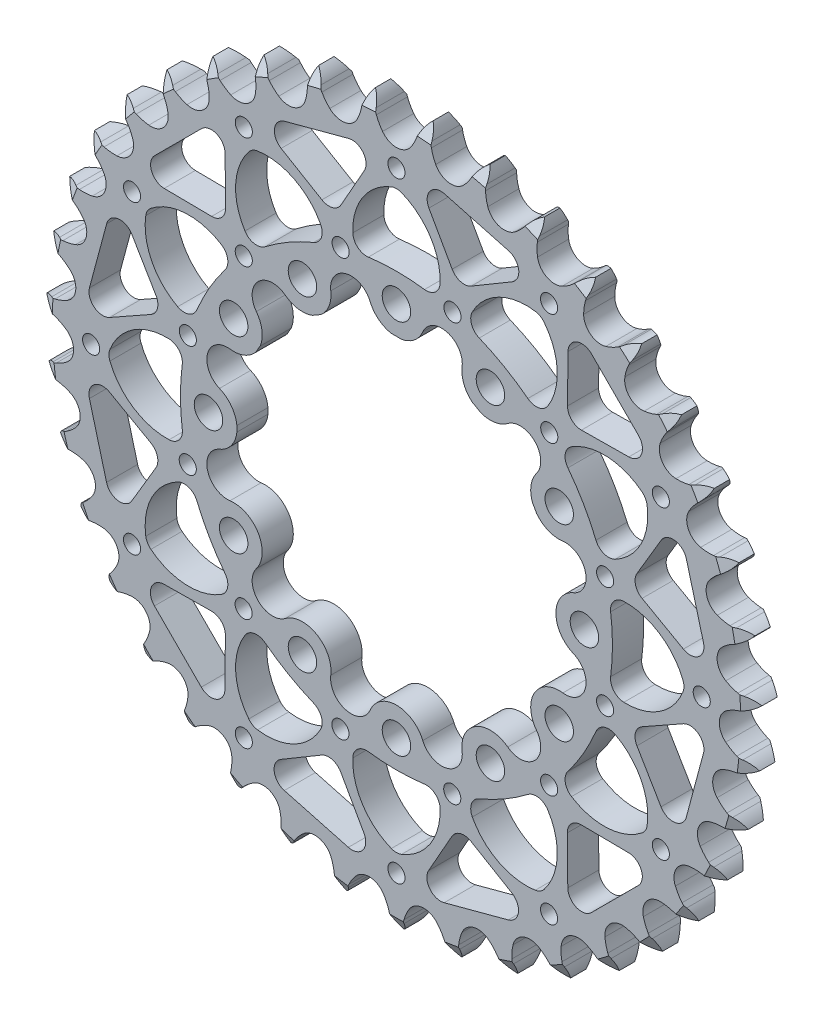
from build123d import *

# Parameters (mm, degrees)
EXTRUSION_DEPTH                = 7.2136
CIRPATTERN1_COUNT              = 12
CUT_EXTRUDE1_DEPTH             = 118.514389318
CUT_EXTRUDE1_DEPTH_BACK        = 118.514389318
SKETCH8_R                      = 37
CENTER_CUTOUT_DEPTH            = 118.514389465
CENTER_CUTOUT_DEPTH_BACK       = 118.514389465
SKETCH11_R                     = 1.984375
PATTERNED_CUTOUT_DEPTH         = 118.514389465
CBORE_FOR_M6_SHCS2_D           = 6.6
CBORE_FOR_M6_SHCS2_CBORE_D     = 11.25
CBORE_FOR_M6_SHCS2_CBORE_DEPTH = 1


with BuildPart() as part:
    # Teeth Sketch → Extrusion (new body)
    with BuildSketch(Plane.XY):
        with BuildLine():
            ThreePointArc((6.676484762, 82.703103732), (5.710873677, 81.555589606), (5.037571935, 80.215493266))
            Line((5.037571935, 80.215493266), (4.65053543, 79.150636707))
            ThreePointArc((4.65053543, 79.150636707), (4.030589042, 77.787636082), (3.22092759, 76.5280518))
            ThreePointArc((3.22092759, 76.5280518), (0, 74.905926143), (-3.22092759, 76.5280518))
            ThreePointArc((-3.22092759, 76.5280518), (-4.030589042, 77.787636082), (-4.65053543, 79.150636707))
            Line((-4.65053543, 79.150636707), (-5.037571935, 80.215493266))
            ThreePointArc((-5.037571935, 80.215493266), (-5.710873677, 81.555589606), (-6.676484762, 82.703103732))
            ThreePointArc((-6.676484762, 82.703103732), (-7.445517227, 81.415554702), (-7.895133318, 79.984807062))
            Line((-7.895133318, 79.984807062), (-8.106342797, 78.871655094))
            ThreePointArc((-8.106342797, 78.871655094), (-8.499620367, 77.426858575), (-9.096745387, 76.053706749))
            ThreePointArc((-9.096745387, 76.053706749), (-12.015755556, 73.935914073), (-15.455180235, 75.020360508))
            ThreePointArc((-15.455180235, 75.020360508), (-16.456408311, 76.133754674), (-17.286967233, 77.379658404))
            Line((-17.286967233, 77.379658404), (-17.83980672, 78.368640329))
            ThreePointArc((-17.83980672, 78.368640329), (-18.719355953, 79.583377579), (-19.856536839, 80.561136787))
            ThreePointArc((-19.856536839, 80.561136787), (-20.409073146, 79.166899696), (-20.623358765, 77.682556369))
            Line((-20.623358765, 77.682556369), (-20.653271004, 76.549939044))
            ThreePointArc((-20.653271004, 76.549939044), (-20.809694072, 75.060766102), (-21.178817437, 73.609610642))
            ThreePointArc((-21.178817437, 73.609610642), (-23.720309356, 71.051000665), (-27.289151829, 71.569681286))
            ThreePointArc((-27.289151829, 71.569681286), (-28.456015249, 72.508049011), (-29.475675664, 73.604587595))
            Line((-29.475675664, 73.604587595), (-30.179999883, 74.492080773))
            ThreePointArc((-30.179999883, 74.492080773), (-31.243016742, 75.549997876), (-32.522315041, 76.332678717))
            ThreePointArc((-32.522315041, 76.332678717), (-32.844044791, 74.867863573), (-32.817450053, 73.368368272))
            Line((-32.817450053, 73.368368272), (-32.66529034, 72.245619783))
            ThreePointArc((-32.66529034, 72.245619783), (-32.580807632, 70.750639215), (-32.71236924, 69.259064285))
            ThreePointArc((-32.71236924, 69.259064285), (-34.810519602, 66.325903661), (-38.416348726, 66.265384911))
            ThreePointArc((-38.416348726, 66.265384911), (-39.71862634, 67.004422965), (-40.900979579, 67.923196629))
            Line((-40.900979579, 67.923196629), (-41.738546902, 68.686215454))
            ThreePointArc((-41.738546902, 68.686215454), (-42.957499809, 69.559912912), (-44.345782367, 70.127244363))
            ThreePointArc((-44.345782367, 70.127244363), (-44.428372928, 68.629789109), (-44.161586623, 67.153977974))
            Line((-44.161586623, 67.153977974), (-43.831295815, 66.070176918))
            ThreePointArc((-43.831295815, 66.070176918), (-43.508095388, 64.608107935), (-43.398687863, 63.114744543))
            ThreePointArc((-43.398687863, 63.114744543), (-44.999155676, 59.883000591), (-48.54858237, 59.244849876))
            ThreePointArc((-48.54858237, 59.244849876), (-49.952545871, 59.765417561), (-51.266969607, 60.48263055))
            Line((-51.266969607, 60.48263055), (-52.21608748, 61.101413234))
            ThreePointArc((-52.21608748, 61.101413234), (-53.559406195, 61.768262742), (-55.020717224, 62.105551216))
            ThreePointArc((-55.020717224, 62.105551216), (-54.862029543, 60.614239157), (-54.361961296, 59.200334922))
            Line((-54.361961296, 59.200334922), (-53.862093752, 58.183551176))
            ThreePointArc((-53.862093752, 58.183551176), (-53.308546327, 56.792260597), (-52.961003266, 55.335786069))
            ThreePointArc((-52.961003266, 55.335786069), (-54.022337255, 51.889159262), (-57.423433231, 50.689904348))
            ThreePointArc((-57.423433231, 50.689904348), (-58.892720703, 50.978519235), (-60.305172051, 51.475596109))
            Line((-60.305172051, 51.475596109), (-61.34125882, 51.934116506))
            ThreePointArc((-61.34125882, 51.934116506), (-62.774152094, 52.376847013), (-64.270644405, 52.475356916))
            ThreePointArc((-64.270644405, 52.475356916), (-63.87478841, 51.02881225), (-63.154389727, 49.713434291))
            Line((-63.154389727, 49.713434291), (-62.497891753, 48.790002021))
            ThreePointArc((-62.497891753, 48.790002021), (-61.728333918, 47.505523541), (-61.151656504, 46.123659804))
            ThreePointArc((-61.151656504, 46.123659804), (-61.646368676, 42.551415963), (-64.811047336, 40.822116924))
            ThreePointArc((-64.811047336, 40.822116924), (-66.307605004, 40.871304038), (-67.781502216, 41.135370767))
            Line((-67.781502216, 41.135370767), (-68.877723777, 41.42175344))
            ThreePointArc((-68.877723777, 41.42175344), (-70.363080428, 41.628898458), (-71.855995657, 41.486078435))
            ThreePointArc((-71.855995657, 41.486078435), (-71.23322381, 40.12176591), (-70.311152637, 38.938981826))
            Line((-70.311152637, 38.938981826), (-69.515027187, 38.132817442))
            ThreePointArc((-69.515027187, 38.132817442), (-68.549390085, 36.988418379), (-67.75851396, 35.716954977))
            ThreePointArc((-67.75851396, 35.716954977), (-67.673791529, 32.111613343), (-70.520089358, 29.897058114))
            ThreePointArc((-70.520089358, 29.897058114), (-72.005157166, 29.705543536), (-73.502327078, 29.729760931))
            Line((-73.502327078, 29.729760931), (-74.630291869, 29.836588719))
            ThreePointArc((-74.630291869, 29.836588719), (-76.129641939, 29.8027833), (-77.580314364, 29.422332315))
            ThreePointArc((-77.580314364, 29.422332315), (-76.74675613, 28.175586908), (-75.646893627, 27.156030185))
            Line((-75.646893627, 27.156030185), (-74.731759931, 26.488012922))
            ThreePointArc((-74.731759931, 26.488012922), (-73.595053056, 25.51333261), (-72.610461496, 24.385199777))
            ThreePointArc((-72.610461496, 24.385199777), (-71.948498729, 20.840136804), (-74.402698108, 18.197681204))
            ThreePointArc((-74.402698108, 18.197681204), (-75.837813579, 17.77042506), (-77.319480277, 17.554165902))
            Line((-77.319480277, 17.554165902), (-78.449974603, 17.478672021))
            ThreePointArc((-78.449974603, 17.478672021), (-79.924485713, 17.204791709), (-81.295343681, 16.596563242))
            ThreePointArc((-81.295343681, 16.596563242), (-80.27258778, 15.499675005), (-79.023419807, 14.669751627))
            Line((-79.023419807, 14.669751627), (-78.012979347, 14.15718278))
            ThreePointArc((-78.012979347, 14.15718278), (-76.734642811, 13.377464928), (-75.58183622, 12.421880712))
            ThreePointArc((-75.58183622, 12.421880712), (-74.359777605, 9.028911669), (-76.358316059, 6.026993909))
            ThreePointArc((-76.358316059, 6.026993909), (-77.706310456, 5.375061909), (-79.134099551, 4.923927198))
            Line((-79.134099551, 4.923927198), (-80.237844202, 4.6680669))
            ThreePointArc((-80.237844202, 4.6680669), (-81.649327289, 4.161205049), (-82.904866299, 3.340951899))
            ThreePointArc((-82.904866299, 3.340951899), (-81.719401571, 2.422329661), (-80.353280924, 1.803534207))
            Line((-80.353280924, 1.803534207), (-79.273703577, 1.45968904))
            ThreePointArc((-79.273703577, 1.45968904), (-77.886845624, 0.895127931), (-76.595681088, 0.136841462))
            ThreePointArc((-76.595681088, 0.136841462), (-74.8451773, -3.016157536), (-76.336293733, -6.299789363))
            ThreePointArc((-76.336293733, -6.299789363), (-77.56225471, -7.159512522), (-78.899187214, -7.833838635))
            Line((-78.899187214, -7.833838635), (-79.947595784, -8.263438702))
            ThreePointArc((-79.947595784, -8.263438702), (-81.259494176, -8.990154635), (-82.367196428, -10.001188343))
            ThreePointArc((-82.367196428, -10.001188343), (-81.049725787, -10.717752749), (-79.602034272, -11.109393802))
            Line((-79.602034272, -11.109393802), (-78.481280524, -11.275609878))
            ThreePointArc((-78.481280524, -11.275609878), (-77.021820047, -11.610392409), (-75.625738049, -12.151741911))
            ThreePointArc((-75.625738049, -12.151741911), (-73.392126218, -14.983109845), (-74.337201497, -18.463411399))
            ThreePointArc((-74.337201497, -18.463411399), (-75.409377308, -19.50865934), (-76.620827372, -20.388712162))
            Line((-76.620827372, -20.388712162), (-77.586746629, -20.980925582))
            ThreePointArc((-77.586746629, -20.980925582), (-78.765082849, -21.908674036), (-79.696259435, -23.08430306))
            ThreePointArc((-79.696259435, -23.08430306), (-78.280904679, -23.580250992), (-76.789136745, -23.734594346))
            Line((-76.789136745, -23.734594346), (-75.656233531, -23.718876424))
            ThreePointArc((-75.656233531, -23.718876424), (-74.161969788, -23.815209685), (-72.697128119, -24.125601551))
            ThreePointArc((-72.697128119, -24.125601551), (-70.038257617, -26.562007479), (-70.41281479, -30.148840778))
            ThreePointArc((-70.41281479, -30.148840778), (-71.303436645, -31.352542128), (-72.358028349, -32.415528753))
            Line((-72.358028349, -32.415528753), (-73.216441492, -33.155017511))
            ThreePointArc((-73.216441492, -33.155017511), (-74.230697248, -34.259770288), (-74.961231185, -35.569546454))
            ThreePointArc((-74.961231185, -35.569546454), (-73.484649258, -35.832033121), (-71.987440912, -35.745081364))
            Line((-71.987440912, -35.745081364), (-70.871729829, -35.547836529))
            ThreePointArc((-70.871729829, -35.547836529), (-69.381363468, -35.403225539), (-67.885700756, -35.474620783))
            ThreePointArc((-67.885700756, -35.474620783), (-64.870434934, -37.452963072), (-64.664773166, -41.053431017))
            ThreePointArc((-64.664773166, -41.053431017), (-65.350774426, -42.384410543), (-66.221194398, -43.602800177))
            Line((-66.221194398, -43.602800177), (-66.949868978, -44.470411902))
            ThreePointArc((-66.949868978, -44.470411902), (-67.773775581, -45.723556485), (-68.284746423, -47.133557278))
            ThreePointArc((-68.284746423, -47.133557278), (-66.785180021, -47.155784414), (-65.321308173, -46.829789551))
            Line((-65.321308173, -46.829789551), (-64.251685552, -46.456126341))
            ThreePointArc((-64.251685552, -46.456126341), (-62.803816278, -46.074316448), (-61.316069403, -45.904865971))
            ThreePointArc((-61.316069403, -45.904865971), (-58.022502061, -47.373906594), (-57.241947884, -50.894758957))
            ThreePointArc((-57.241947884, -50.894758957), (-57.705561477, -52.318544989), (-58.369266298, -53.66078198))
            Line((-58.369266298, -53.66078198), (-58.949330025, -54.634045983))
            ThreePointArc((-58.949330025, -54.634045983), (-59.561548726, -56.003126587), (-59.839722596, -57.476833727))
            ThreePointArc((-59.839722596, -57.476833727), (-58.356009703, -57.25822566), (-56.963387864, -56.701630787))
            Line((-56.963387864, -56.701630787), (-55.967556369, -56.161226883))
            ThreePointArc((-55.967556369, -56.161226883), (-54.599683236, -55.552106762), (-53.15838406, -55.146199243))
            ThreePointArc((-53.15838406, -55.146199243), (-49.671816862, -56.06789082), (-48.336586219, -59.417939375))
            ThreePointArc((-48.336586219, -59.417939375), (-48.565804798, -60.897656602), (-49.00560486, -62.328977716))
            Line((-49.00560486, -62.328977716), (-49.422034389, -63.382686971))
            ThreePointArc((-49.422034389, -63.382686971), (-49.806709045, -64.832245127), (-49.844881387, -66.331490374))
            ThreePointArc((-49.844881387, -66.331490374), (-48.415449386, -65.877708938), (-47.130145731, -65.104929569))
            Line((-47.130145731, -65.104929569), (-46.233896874, -64.411781148))
            ThreePointArc((-46.233896874, -64.411781148), (-44.981447078, -63.591126692), (-43.623924493, -62.959274922))
            ThreePointArc((-43.623924493, -62.959274922), (-40.034657698, -63.309746125), (-38.179332362, -66.402226373))
            ThreePointArc((-38.179332362, -66.402226373), (-38.168219284, -67.899550896), (-38.372723998, -69.38288567))
            Line((-38.372723998, -69.38288567), (-38.614734022, -70.489749661))
            ThreePointArc((-38.614734022, -70.489749661), (-38.761901763, -71.982242573), (-38.559083932, -73.468196262))
            ThreePointArc((-38.559083932, -73.468196262), (-37.220954361, -72.790994159), (-36.076257579, -71.822044874))
            Line((-36.076257579, -71.822044874), (-35.302803736, -70.994104116))
            ThreePointArc((-35.302803736, -70.994104116), (-34.198215068, -69.983169844), (-32.959628196, -69.141738451))
            ThreePointArc((-32.959628196, -69.141738451), (-29.360621929, -68.91191226), (-27.033253851, -71.666730588))
            ThreePointArc((-27.033253851, -71.666730588), (-26.78209694, -73.142882488), (-26.74600974, -74.639813329))
            Line((-26.74600974, -74.639813329), (-26.807332328, -75.77116486))
            ThreePointArc((-26.807332328, -75.77116486), (-26.713181585, -77.267937748), (-26.274626458, -78.702114459))
            ThreePointArc((-26.274626458, -78.702114459), (-25.06245617, -77.819030866), (-24.088013307, -76.679006943))
            Line((-24.088013307, -76.679006943), (-23.457386525, -75.737717079))
            ThreePointArc((-23.457386525, -75.737717079), (-22.529267252, -74.562685657), (-21.441694841, -73.533467273))
            ThreePointArc((-21.441694841, -73.533467273), (-17.926161474, -72.729296065), (-15.187028265, -75.075104125))
            ThreePointArc((-15.187028265, -75.075104125), (-14.702332353, -76.491851845), (-14.426587879, -77.96360903))
            Line((-14.426587879, -77.96360903), (-14.305634807, -79.090146691))
            ThreePointArc((-14.305634807, -79.090146691), (-13.972604036, -80.552433921), (-13.309669959, -81.897689231))
            ThreePointArc((-13.309669959, -81.897689231), (-12.254853529, -80.83159555), (-11.475902142, -79.55002301))
            Line((-11.475902142, -79.55002301), (-11.004435324, -78.519762952))
            ThreePointArc((-11.004435324, -78.519762952), (-10.276823247, -77.211067077), (-9.368432854, -76.020717918))
            ThreePointArc((-9.368432854, -76.020717918), (-6.027422853, -74.663029306), (-2.947466624, -76.5390719))
            ThreePointArc((-2.947466624, -76.5390719), (-2.241785081, -77.859722417), (-1.733524971, -79.26818821))
            Line((-1.733524971, -79.26818821), (-1.43342886, -80.360735266))
            ThreePointArc((-1.43342886, -80.360735266), (-0.870143382, -81.750664368), (0, -82.97215687))
            ThreePointArc((0, -82.97215687), (0.870143382, -81.750664368), (1.43342886, -80.360735266))
            Line((1.43342886, -80.360735266), (1.733524971, -79.26818821))
            ThreePointArc((1.733524971, -79.26818821), (2.241785081, -77.859722417), (2.947466624, -76.5390719))
            ThreePointArc((2.947466624, -76.5390719), (6.027422853, -74.663029306), (9.368432854, -76.020717918))
            ThreePointArc((9.368432854, -76.020717918), (10.276823247, -77.211067077), (11.004435324, -78.519762952))
            Line((11.004435324, -78.519762952), (11.475902142, -79.55002301))
            ThreePointArc((11.475902142, -79.55002301), (12.254853529, -80.83159555), (13.309669959, -81.897689231))
            ThreePointArc((13.309669959, -81.897689231), (13.972604036, -80.552433921), (14.305634807, -79.090146691))
            Line((14.305634807, -79.090146691), (14.426587879, -77.96360903))
            ThreePointArc((14.426587879, -77.96360903), (14.702332353, -76.491851845), (15.187028265, -75.075104125))
            ThreePointArc((15.187028265, -75.075104125), (17.926161474, -72.729296065), (21.441694841, -73.533467273))
            ThreePointArc((21.441694841, -73.533467273), (22.529267252, -74.562685657), (23.457386525, -75.737717079))
            Line((23.457386525, -75.737717079), (24.088013307, -76.679006943))
            ThreePointArc((24.088013307, -76.679006943), (25.06245617, -77.819030866), (26.274626458, -78.702114459))
            ThreePointArc((26.274626458, -78.702114459), (26.713181585, -77.267937748), (26.807332328, -75.77116486))
            Line((26.807332328, -75.77116486), (26.74600974, -74.639813329))
            ThreePointArc((26.74600974, -74.639813329), (26.78209694, -73.142882488), (27.033253851, -71.666730588))
            ThreePointArc((27.033253851, -71.666730588), (29.360621929, -68.91191226), (32.959628196, -69.141738451))
            ThreePointArc((32.959628196, -69.141738451), (34.198215068, -69.983169844), (35.302803736, -70.994104116))
            Line((35.302803736, -70.994104116), (36.076257579, -71.822044874))
            ThreePointArc((36.076257579, -71.822044874), (37.220954361, -72.790994159), (38.559083932, -73.468196262))
            ThreePointArc((38.559083932, -73.468196262), (38.761901763, -71.982242573), (38.614734022, -70.489749661))
            Line((38.614734022, -70.489749661), (38.372723998, -69.38288567))
            ThreePointArc((38.372723998, -69.38288567), (38.168219284, -67.899550896), (38.179332362, -66.402226373))
            ThreePointArc((38.179332362, -66.402226373), (40.034657698, -63.309746125), (43.623924493, -62.959274922))
            ThreePointArc((43.623924493, -62.959274922), (44.981447078, -63.591126692), (46.233896874, -64.411781148))
            Line((46.233896874, -64.411781148), (47.130145731, -65.104929569))
            ThreePointArc((47.130145731, -65.104929569), (48.415449386, -65.877708938), (49.844881387, -66.331490374))
            ThreePointArc((49.844881387, -66.331490374), (49.806709045, -64.832245127), (49.422034389, -63.382686971))
            Line((49.422034389, -63.382686971), (49.00560486, -62.328977716))
            ThreePointArc((49.00560486, -62.328977716), (48.565804798, -60.897656602), (48.336586219, -59.417939375))
            ThreePointArc((48.336586219, -59.417939375), (49.671816862, -56.06789082), (53.15838406, -55.146199243))
            ThreePointArc((53.15838406, -55.146199243), (54.599683236, -55.552106762), (55.967556369, -56.161226883))
            Line((55.967556369, -56.161226883), (56.963387864, -56.701630787))
            ThreePointArc((56.963387864, -56.701630787), (58.356009703, -57.25822566), (59.839722596, -57.476833727))
            ThreePointArc((59.839722596, -57.476833727), (59.561548726, -56.003126587), (58.949330025, -54.634045983))
            Line((58.949330025, -54.634045983), (58.369266298, -53.66078198))
            ThreePointArc((58.369266298, -53.66078198), (57.705561477, -52.318544989), (57.241947884, -50.894758957))
            ThreePointArc((57.241947884, -50.894758957), (58.022502061, -47.373906594), (61.316069403, -45.904865971))
            ThreePointArc((61.316069403, -45.904865971), (62.803816278, -46.074316448), (64.251685552, -46.456126341))
            Line((64.251685552, -46.456126341), (65.321308173, -46.829789551))
            ThreePointArc((65.321308173, -46.829789551), (66.785180021, -47.155784414), (68.284746423, -47.133557278))
            ThreePointArc((68.284746423, -47.133557278), (67.773775581, -45.723556485), (66.949868978, -44.470411902))
            Line((66.949868978, -44.470411902), (66.221194398, -43.602800177))
            ThreePointArc((66.221194398, -43.602800177), (65.350774426, -42.384410543), (64.664773166, -41.053431017))
            ThreePointArc((64.664773166, -41.053431017), (64.870434934, -37.452963072), (67.885700756, -35.474620783))
            ThreePointArc((67.885700756, -35.474620783), (69.381363468, -35.403225539), (70.871729829, -35.547836529))
            Line((70.871729829, -35.547836529), (71.987440912, -35.745081364))
            ThreePointArc((71.987440912, -35.745081364), (73.484649258, -35.832033121), (74.961231185, -35.569546454))
            ThreePointArc((74.961231185, -35.569546454), (74.230697248, -34.259770288), (73.216441492, -33.155017511))
            Line((73.216441492, -33.155017511), (72.358028349, -32.415528753))
            ThreePointArc((72.358028349, -32.415528753), (71.303436645, -31.352542128), (70.41281479, -30.148840778))
            ThreePointArc((70.41281479, -30.148840778), (70.038257617, -26.562007479), (72.697128119, -24.125601551))
            ThreePointArc((72.697128119, -24.125601551), (74.161969788, -23.815209685), (75.656233531, -23.718876424))
            Line((75.656233531, -23.718876424), (76.789136745, -23.734594346))
            ThreePointArc((76.789136745, -23.734594346), (78.280904679, -23.580250992), (79.696259435, -23.08430306))
            ThreePointArc((79.696259435, -23.08430306), (78.765082849, -21.908674036), (77.586746629, -20.980925582))
            Line((77.586746629, -20.980925582), (76.620827372, -20.388712162))
            ThreePointArc((76.620827372, -20.388712162), (75.409377308, -19.50865934), (74.337201497, -18.463411399))
            ThreePointArc((74.337201497, -18.463411399), (73.392126218, -14.983109845), (75.625738049, -12.151741911))
            ThreePointArc((75.625738049, -12.151741911), (77.021820047, -11.610392409), (78.481280524, -11.275609878))
            Line((78.481280524, -11.275609878), (79.602034272, -11.109393802))
            ThreePointArc((79.602034272, -11.109393802), (81.049725787, -10.717752749), (82.367196428, -10.001188343))
            ThreePointArc((82.367196428, -10.001188343), (81.259494176, -8.990154635), (79.947595784, -8.263438702))
            Line((79.947595784, -8.263438702), (78.899187214, -7.833838635))
            ThreePointArc((78.899187214, -7.833838635), (77.56225471, -7.159512522), (76.336293733, -6.299789363))
            ThreePointArc((76.336293733, -6.299789363), (74.8451773, -3.016157536), (76.595681088, 0.136841462))
            ThreePointArc((76.595681088, 0.136841462), (77.886845624, 0.895127931), (79.273703577, 1.45968904))
            Line((79.273703577, 1.45968904), (80.353280924, 1.803534207))
            ThreePointArc((80.353280924, 1.803534207), (81.719401571, 2.422329661), (82.904866299, 3.340951899))
            ThreePointArc((82.904866299, 3.340951899), (81.649327289, 4.161205049), (80.237844202, 4.6680669))
            Line((80.237844202, 4.6680669), (79.134099551, 4.923927198))
            ThreePointArc((79.134099551, 4.923927198), (77.706310456, 5.375061909), (76.358316059, 6.026993909))
            ThreePointArc((76.358316059, 6.026993909), (74.359777605, 9.028911669), (75.58183622, 12.421880712))
            ThreePointArc((75.58183622, 12.421880712), (76.734642811, 13.377464928), (78.012979347, 14.15718278))
            Line((78.012979347, 14.15718278), (79.023419807, 14.669751627))
            ThreePointArc((79.023419807, 14.669751627), (80.27258778, 15.499675005), (81.295343681, 16.596563242))
            ThreePointArc((81.295343681, 16.596563242), (79.924485713, 17.204791709), (78.449974603, 17.478672021))
            Line((78.449974603, 17.478672021), (77.319480277, 17.554165902))
            ThreePointArc((77.319480277, 17.554165902), (75.837813579, 17.77042506), (74.402698108, 18.197681204))
            ThreePointArc((74.402698108, 18.197681204), (71.948498729, 20.840136804), (72.610461496, 24.385199777))
            ThreePointArc((72.610461496, 24.385199777), (73.595053056, 25.51333261), (74.731759931, 26.488012922))
            Line((74.731759931, 26.488012922), (75.646893627, 27.156030185))
            ThreePointArc((75.646893627, 27.156030185), (76.74675613, 28.175586908), (77.580314364, 29.422332315))
            ThreePointArc((77.580314364, 29.422332315), (76.129641939, 29.8027833), (74.630291869, 29.836588719))
            Line((74.630291869, 29.836588719), (73.502327078, 29.729760931))
            ThreePointArc((73.502327078, 29.729760931), (72.005157166, 29.705543536), (70.520089358, 29.897058114))
            ThreePointArc((70.520089358, 29.897058114), (67.673791529, 32.111613343), (67.75851396, 35.716954977))
            ThreePointArc((67.75851396, 35.716954977), (68.549390085, 36.988418379), (69.515027187, 38.132817442))
            Line((69.515027187, 38.132817442), (70.311152637, 38.938981826))
            ThreePointArc((70.311152637, 38.938981826), (71.23322381, 40.12176591), (71.855995657, 41.486078435))
            ThreePointArc((71.855995657, 41.486078435), (70.363080428, 41.628898458), (68.877723777, 41.42175344))
            Line((68.877723777, 41.42175344), (67.781502216, 41.135370767))
            ThreePointArc((67.781502216, 41.135370767), (66.307605004, 40.871304038), (64.811047336, 40.822116924))
            ThreePointArc((64.811047336, 40.822116924), (61.646368676, 42.551415963), (61.151656504, 46.123659804))
            ThreePointArc((61.151656504, 46.123659804), (61.728333918, 47.505523541), (62.497891753, 48.790002021))
            Line((62.497891753, 48.790002021), (63.154389727, 49.713434291))
            ThreePointArc((63.154389727, 49.713434291), (63.87478841, 51.02881225), (64.270644405, 52.475356916))
            ThreePointArc((64.270644405, 52.475356916), (62.774152094, 52.376847013), (61.34125882, 51.934116506))
            Line((61.34125882, 51.934116506), (60.305172051, 51.475596109))
            ThreePointArc((60.305172051, 51.475596109), (58.892720703, 50.978519235), (57.423433231, 50.689904348))
            ThreePointArc((57.423433231, 50.689904348), (54.022337255, 51.889159262), (52.961003266, 55.335786069))
            ThreePointArc((52.961003266, 55.335786069), (53.308546327, 56.792260597), (53.862093752, 58.183551176))
            Line((53.862093752, 58.183551176), (54.361961296, 59.200334922))
            ThreePointArc((54.361961296, 59.200334922), (54.862029543, 60.614239157), (55.020717224, 62.105551216))
            ThreePointArc((55.020717224, 62.105551216), (53.559406195, 61.768262742), (52.21608748, 61.101413234))
            Line((52.21608748, 61.101413234), (51.266969607, 60.48263055))
            ThreePointArc((51.266969607, 60.48263055), (49.952545871, 59.765417561), (48.54858237, 59.244849876))
            ThreePointArc((48.54858237, 59.244849876), (44.999155676, 59.883000591), (43.398687863, 63.114744543))
            ThreePointArc((43.398687863, 63.114744543), (43.508095388, 64.608107935), (43.831295815, 66.070176918))
            Line((43.831295815, 66.070176918), (44.161586623, 67.153977974))
            ThreePointArc((44.161586623, 67.153977974), (44.428372928, 68.629789109), (44.345782367, 70.127244363))
            ThreePointArc((44.345782367, 70.127244363), (42.957499809, 69.559912912), (41.738546902, 68.686215454))
            Line((41.738546902, 68.686215454), (40.900979579, 67.923196629))
            ThreePointArc((40.900979579, 67.923196629), (39.71862634, 67.004422965), (38.416348726, 66.265384911))
            ThreePointArc((38.416348726, 66.265384911), (34.810519602, 66.325903661), (32.71236924, 69.259064285))
            ThreePointArc((32.71236924, 69.259064285), (32.580807632, 70.750639215), (32.66529034, 72.245619783))
            Line((32.66529034, 72.245619783), (32.817450053, 73.368368272))
            ThreePointArc((32.817450053, 73.368368272), (32.844044791, 74.867863573), (32.522315041, 76.332678717))
            ThreePointArc((32.522315041, 76.332678717), (31.243016742, 75.549997876), (30.179999883, 74.492080773))
            Line((30.179999883, 74.492080773), (29.475675664, 73.604587595))
            ThreePointArc((29.475675664, 73.604587595), (28.456015249, 72.508049011), (27.289151829, 71.569681286))
            ThreePointArc((27.289151829, 71.569681286), (23.720309356, 71.051000665), (21.178817437, 73.609610642))
            ThreePointArc((21.178817437, 73.609610642), (20.809694072, 75.060766102), (20.653271004, 76.549939044))
            Line((20.653271004, 76.549939044), (20.623358765, 77.682556369))
            ThreePointArc((20.623358765, 77.682556369), (20.409073146, 79.166899696), (19.856536839, 80.561136787))
            ThreePointArc((19.856536839, 80.561136787), (18.719355953, 79.583377579), (17.83980672, 78.368640329))
            Line((17.83980672, 78.368640329), (17.286967233, 77.379658404))
            ThreePointArc((17.286967233, 77.379658404), (16.456408311, 76.133754674), (15.455180235, 75.020360508))
            ThreePointArc((15.455180235, 75.020360508), (12.015755556, 73.935914073), (9.096745387, 76.053706749))
            ThreePointArc((9.096745387, 76.053706749), (8.499620367, 77.426858575), (8.106342797, 78.871655094))
            Line((8.106342797, 78.871655094), (7.895133318, 79.984807062))
            ThreePointArc((7.895133318, 79.984807062), (7.445517227, 81.415554702), (6.676484762, 82.703103732))
        make_face()
    extrude(amount=EXTRUSION_DEPTH)

    # Sketch4 → M6 Clearance Hole1 (revolve, cut)
    with BuildSketch(Plane(origin=(0, 43.500000122, 0), x_dir=(0, 1, 0), z_dir=(1, 0, 0))):
        Polygon((0, 0), (0, 19.254840043), (3.3, 17.272), (3.3, 0), align=None)
    m6_clearance_hole1 = revolve(axis=Axis((0, 43.500000122, -6.35), (0, 0, 1)), mode=Mode.SUBTRACT)

    # CirPattern1: M6 Clearance Hole1 ×12 about axis
    cirpattern1_axis = Axis((0, -0.078817912, 0), (0, 0, 1))
    for i in range(1, CIRPATTERN1_COUNT):
        add(m6_clearance_hole1.rotate(cirpattern1_axis, i * 360 / CIRPATTERN1_COUNT), mode=Mode.SUBTRACT)

    # Sketch8 → Cut-Extrude1 (cut, two sides: drawn at the far end of the back side and taken through both)
    with BuildSketch(Plane(origin=(0, 0, 0), x_dir=(-1, 0, 0), z_dir=(0, 0, -1)).offset(-CUT_EXTRUDE1_DEPTH_BACK)):
        Circle(SKETCH8_R)
    extrude(amount=CUT_EXTRUDE1_DEPTH + CUT_EXTRUDE1_DEPTH_BACK, mode=Mode.SUBTRACT)

    # Sketch5 → Cut-Revolve1 (revolve, cut)
    with BuildSketch(Plane(origin=(0, 0, 0), x_dir=(0, 0, -1), z_dir=(1, 0, 0))):
        Polygon((-7.2136, -79.778574738), (-7.2136, -82.97215687), (-5.3848, -82.97215687), align=None)
    cut_revolve1 = revolve(axis=Axis((0, 0, 7.2136), (0, 0, -1)), mode=Mode.SUBTRACT)

    # Mirror1: Cut-Revolve1 across plane
    add(cut_revolve1.mirror(Plane.XY.offset(3.6068)), mode=Mode.SUBTRACT)

    # Sketch9 → Center Cutout (cut, two sides: drawn at the far end of the back side and taken through both)
    with BuildSketch(Plane.XY.offset(7.2136).offset(-CENTER_CUTOUT_DEPTH_BACK)):
        with BuildLine():
            ThreePointArc((1.148678559, 36.982165128), (0, 36.881719723), (-1.148678559, 36.982165128))
            ThreePointArc((-1.148678559, 36.982165128), (-9.617726785, 35.728130814), (-17.571834052, 32.561183149))
            ThreePointArc((-17.571834052, 32.561183149), (-18.475078878, 31.932946165), (-19.469920872, 31.463028799))
            ThreePointArc((-19.469920872, 31.463028799), (-22.757183287, 31.114405097), (-25.803005362, 32.399162099))
            ThreePointArc((-25.803005362, 32.399162099), (-32.058776499, 31.979958587), (-32.477980012, 25.72418745))
            ThreePointArc((-32.477980012, 25.72418745), (-31.470213373, 23.82881041), (-31.122083086, 21.710591105))
            ThreePointArc((-31.122083086, 21.710591105), (-31.241007029, 20.461591061), (-31.59350497, 19.257477605))
            ThreePointArc((-31.59350497, 19.257477605), (-32.00358372, 18.410440597), (-32.529655862, 17.630130162))
            ThreePointArc((-32.529655862, 17.630130162), (-35.22884515, 15.587363925), (-38.585048144, 15.14643516))
            ThreePointArc((-38.585048144, 15.14643516), (-43.793103112, 11.655508701), (-41.028258435, 6.02825022))
            ThreePointArc((-41.028258435, 6.02825022), (-38.265449818, 3.867034802), (-36.99517654, 0.597421776))
            ThreePointArc((-36.99517654, 0.597421776), (-36.969203034, 0.259745217), (-36.960537635, -0.078817912))
            ThreePointArc((-36.960537635, -0.078817912), (-36.968601511, -0.405426166), (-36.992773486, -0.731238524))
            ThreePointArc((-36.992773486, -0.731238524), (-38.258321936, -4.015054276), (-41.028258435, -6.185886044))
            ThreePointArc((-41.028258435, -6.185886044), (-43.793103112, -11.813144525), (-38.585048144, -15.304070984))
            ThreePointArc((-38.585048144, -15.304070984), (-33.369363855, -16.898720145), (-31.122083086, -21.868226929))
            ThreePointArc((-31.122083086, -21.868226929), (-31.470213373, -23.986446234), (-32.477980012, -25.881823274))
            ThreePointArc((-32.477980012, -25.881823274), (-32.058776499, -32.137594411), (-25.803005362, -32.556797924))
            ThreePointArc((-25.803005362, -32.556797924), (-18.853550589, -31.887708499), (-15.171128618, -37.819181396))
            ThreePointArc((-15.171128618, -37.819181396), (-15.184673592, -38.242389865), (-15.225253072, -38.663866056))
            ThreePointArc((-15.225253072, -38.663866056), (-11.734326613, -43.871921024), (-6.107068132, -41.107076347))
            ThreePointArc((-6.107068132, -41.107076347), (0, -37.039355547), (6.107068132, -41.107076347))
            ThreePointArc((6.107068132, -41.107076347), (11.734326613, -43.871921024), (15.225253072, -38.663866056))
            ThreePointArc((15.225253072, -38.663866056), (18.480268818, -32.087582442), (25.803005362, -32.556797924))
            ThreePointArc((25.803005362, -32.556797924), (32.058776499, -32.137594411), (32.477980012, -25.881823274))
            ThreePointArc((32.477980012, -25.881823274), (31.135298942, -22.286267386), (32.013950026, -18.550121394))
            ThreePointArc((32.013950026, -18.550121394), (35.635096733, -9.956901166), (36.992773486, -0.731238524))
            ThreePointArc((36.992773486, -0.731238524), (36.96054846, -0.066847918), (36.99517654, 0.597421776))
            ThreePointArc((36.99517654, 0.597421776), (35.79041588, 9.383289996), (32.529655862, 17.630130162))
            ThreePointArc((32.529655862, 17.630130162), (32.00358372, 18.410440597), (31.59350497, 19.257477605))
            ThreePointArc((31.59350497, 19.257477605), (31.183132, 22.607447115), (32.477980012, 25.72418745))
            ThreePointArc((32.477980012, 25.72418745), (32.058776499, 31.979958587), (25.803005362, 32.399162099))
            ThreePointArc((25.803005362, 32.399162099), (22.757183287, 31.114405097), (19.469920872, 31.463028799))
            ThreePointArc((19.469920872, 31.463028799), (18.475078878, 31.932946165), (17.571834052, 32.561183149))
            ThreePointArc((17.571834052, 32.561183149), (9.617726785, 35.728130814), (1.148678559, 36.982165128))
        make_face()
        with BuildLine():
            ThreePointArc((41.028258435, -6.185886044), (38.258321936, -4.015054276), (36.992773486, -0.731238524))
            ThreePointArc((36.992773486, -0.731238524), (35.635096733, -9.956901166), (32.013950026, -18.550121394))
            ThreePointArc((32.013950026, -18.550121394), (34.809147042, -15.934458682), (38.585048144, -15.304070984))
            ThreePointArc((38.585048144, -15.304070984), (43.793103112, -11.813144525), (41.028258435, -6.185886044))
        make_face()
        with BuildLine():
            ThreePointArc((41.028258435, 6.02825022), (43.793103112, 11.655508701), (38.585048144, 15.14643516))
            ThreePointArc((38.585048144, 15.14643516), (35.22884515, 15.587363925), (32.529655862, 17.630130162))
            ThreePointArc((32.529655862, 17.630130162), (35.79041588, 9.383289996), (36.99517654, 0.597421776))
            ThreePointArc((36.99517654, 0.597421776), (38.265449818, 3.867034802), (41.028258435, 6.02825022))
        make_face()
        with BuildLine():
            ThreePointArc((-1.148678559, 36.982165128), (-4.134765232, 38.332278002), (-6.107068132, 40.949440523))
            ThreePointArc((-6.107068132, 40.949440523), (-11.734326613, 43.7142852), (-15.225253072, 38.506230231))
            ThreePointArc((-15.225253072, 38.506230231), (-15.184673592, 38.08475404), (-15.171128618, 37.661545572))
            ThreePointArc((-15.171128618, 37.661545572), (-15.801307099, 34.842987278), (-17.571834052, 32.561183149))
            ThreePointArc((-17.571834052, 32.561183149), (-9.617726785, 35.728130814), (-1.148678559, 36.982165128))
        make_face()
        with BuildLine():
            ThreePointArc((15.225253072, 38.506230231), (11.734326613, 43.7142852), (6.107068132, 40.949440523))
            ThreePointArc((6.107068132, 40.949440523), (4.134765232, 38.332278002), (1.148678559, 36.982165128))
            ThreePointArc((1.148678559, 36.982165128), (9.617726785, 35.728130814), (17.571834052, 32.561183149))
            ThreePointArc((17.571834052, 32.561183149), (15.633328563, 35.231667205), (15.225253072, 38.506230231))
        make_face()
    extrude(amount=CENTER_CUTOUT_DEPTH + CENTER_CUTOUT_DEPTH_BACK, mode=Mode.SUBTRACT)

    # Sketch11 → Patterned Cutout (cut, through all)
    with BuildSketch(Plane.XY.offset(7.2136)):
        with Locations((12.985733143, 48.365954662)):
            Circle(SKETCH11_R)
        with Locations((35.428952119, 35.393278844)):
            Circle(SKETCH11_R)
        with Locations((48.379011987, 12.937002543)):
            Circle(SKETCH11_R)
        with Locations((48.365954662, -12.985733143)):
            Circle(SKETCH11_R)
        with Locations((35.393278844, -35.428952119)):
            Circle(SKETCH11_R)
        with Locations((12.937002543, -48.379011987)):
            Circle(SKETCH11_R)
        with Locations((-12.985733143, -48.365954662)):
            Circle(SKETCH11_R)
        with Locations((-35.428952119, -35.393278844)):
            Circle(SKETCH11_R)
        with Locations((-48.379011987, -12.937002543)):
            Circle(SKETCH11_R)
        with Locations((-48.365954662, 12.985733143)):
            Circle(SKETCH11_R)
        with Locations((-35.393278844, 35.428952119)):
            Circle(SKETCH11_R)
        with Locations((-12.937002543, 48.379011987)):
            Circle(SKETCH11_R)
        with Locations((0, 70.777173596)):
            Circle(SKETCH11_R)
        with Locations((35.388586798, 61.294830342)):
            Circle(SKETCH11_R)
        with Locations((61.294830342, 35.388586798)):
            Circle(SKETCH11_R)
        with Locations((70.777173596, 0)):
            Circle(SKETCH11_R)
        with Locations((61.294830342, -35.388586798)):
            Circle(SKETCH11_R)
        with Locations((35.388586798, -61.294830342)):
            Circle(SKETCH11_R)
        with Locations((0, -70.777173596)):
            Circle(SKETCH11_R)
        with Locations((-35.388586798, -61.294830342)):
            Circle(SKETCH11_R)
        with Locations((-61.294830342, -35.388586798)):
            Circle(SKETCH11_R)
        with Locations((-70.777173596, 0)):
            Circle(SKETCH11_R)
        with Locations((-61.294830342, 35.388586798)):
            Circle(SKETCH11_R)
        with Locations((-35.388586798, 61.294830342)):
            Circle(SKETCH11_R)
        with BuildLine():
            Line((25.997282294, 67.18379982), (11.149295872, 71.170322793))
            ThreePointArc((11.149295872, 71.170322793), (7.791655009, 70.042295545), (7.530287758, 66.509890586))
            Line((7.530287758, 66.509890586), (12.918562286, 56.934502126))
            ThreePointArc((12.918562286, 56.934502126), (14.877807432, 55.413071545), (17.33561802, 55.74857067))
            Line((17.33561802, 55.74857067), (26.795329914, 61.337436156))
            ThreePointArc((26.795329914, 61.337436156), (28.338394384, 64.525719343), (25.997282294, 67.18379982))
        make_face()
        with BuildLine():
            Line((39.655054183, 42.84744405), (39.776365789, 53.834110971))
            ThreePointArc((39.776365789, 53.834110971), (41.768918948, 56.762579777), (45.240734856, 56.060659598))
            Line((45.240734856, 56.060659598), (56.106206806, 45.18423622))
            ThreePointArc((56.106206806, 45.18423622), (56.80462911, 41.711714957), (53.874154487, 39.722112957))
            Line((53.874154487, 39.722112957), (42.887370931, 39.611869415))
            ThreePointArc((42.887370931, 39.611869415), (40.591094961, 40.550223944), (39.655054183, 42.84744405))
        make_face()
        with BuildLine():
            Line((55.766006336, 17.279447943), (61.364398729, 26.733524797))
            ThreePointArc((61.364398729, 26.733524797), (64.554234786, 28.273376597), (67.20995547, 25.929587937))
            Line((67.20995547, 25.929587937), (71.181518514, 11.077593014))
            ThreePointArc((71.181518514, 11.077593014), (70.05010934, 7.721090233), (66.517442872, 7.46328167))
            Line((66.517442872, 7.46328167), (56.947487435, 12.861199739))
            ThreePointArc((56.947487435, 12.861199739), (55.428031376, 14.821976584), (55.766006336, 17.279447943))
        make_face()
        with BuildLine():
            Line((56.934502126, -12.918562286), (66.509890586, -7.530287758))
            ThreePointArc((66.509890586, -7.530287758), (70.042295545, -7.791655009), (71.170322793, -11.149295872))
            Line((71.170322793, -11.149295872), (67.18379982, -25.997282294))
            ThreePointArc((67.18379982, -25.997282294), (64.525719343, -28.338394384), (61.337436156, -26.795329914))
            Line((61.337436156, -26.795329914), (55.74857067, -17.33561802))
            ThreePointArc((55.74857067, -17.33561802), (55.413071545, -14.877807432), (56.934502126, -12.918562286))
        make_face()
        with BuildLine():
            Line((42.84744405, -39.655054183), (53.834110971, -39.776365789))
            ThreePointArc((53.834110971, -39.776365789), (56.762579777, -41.768918948), (56.060659598, -45.240734856))
            Line((56.060659598, -45.240734856), (45.18423622, -56.106206806))
            ThreePointArc((45.18423622, -56.106206806), (41.711714957, -56.80462911), (39.722112957, -53.874154487))
            Line((39.722112957, -53.874154487), (39.611869415, -42.887370931))
            ThreePointArc((39.611869415, -42.887370931), (40.550223944, -40.591094961), (42.84744405, -39.655054183))
        make_face()
        with BuildLine():
            Line((17.279447943, -55.766006336), (26.733524797, -61.364398729))
            ThreePointArc((26.733524797, -61.364398729), (28.273376597, -64.554234786), (25.929587937, -67.20995547))
            Line((25.929587937, -67.20995547), (11.077593014, -71.181518514))
            ThreePointArc((11.077593014, -71.181518514), (7.721090233, -70.05010934), (7.46328167, -66.517442872))
            Line((7.46328167, -66.517442872), (12.861199739, -56.947487435))
            ThreePointArc((12.861199739, -56.947487435), (14.821976584, -55.428031376), (17.279447943, -55.766006336))
        make_face()
        with BuildLine():
            Line((-12.918562286, -56.934502126), (-7.530287758, -66.509890586))
            ThreePointArc((-7.530287758, -66.509890586), (-7.791655009, -70.042295545), (-11.149295872, -71.170322793))
            Line((-11.149295872, -71.170322793), (-25.997282294, -67.18379982))
            ThreePointArc((-25.997282294, -67.18379982), (-28.338394384, -64.525719343), (-26.795329914, -61.337436156))
            Line((-26.795329914, -61.337436156), (-17.33561802, -55.74857067))
            ThreePointArc((-17.33561802, -55.74857067), (-14.877807432, -55.413071545), (-12.918562286, -56.934502126))
        make_face()
        with BuildLine():
            Line((-39.655054183, -42.84744405), (-39.776365789, -53.834110971))
            ThreePointArc((-39.776365789, -53.834110971), (-41.768918948, -56.762579777), (-45.240734856, -56.060659598))
            Line((-45.240734856, -56.060659598), (-56.106206806, -45.18423622))
            ThreePointArc((-56.106206806, -45.18423622), (-56.80462911, -41.711714957), (-53.874154487, -39.722112957))
            Line((-53.874154487, -39.722112957), (-42.887370931, -39.611869415))
            ThreePointArc((-42.887370931, -39.611869415), (-40.591094961, -40.550223944), (-39.655054183, -42.84744405))
        make_face()
        with BuildLine():
            Line((-55.766006336, -17.279447943), (-61.364398729, -26.733524797))
            ThreePointArc((-61.364398729, -26.733524797), (-64.554234786, -28.273376597), (-67.20995547, -25.929587937))
            Line((-67.20995547, -25.929587937), (-71.181518514, -11.077593014))
            ThreePointArc((-71.181518514, -11.077593014), (-70.05010934, -7.721090233), (-66.517442872, -7.46328167))
            Line((-66.517442872, -7.46328167), (-56.947487435, -12.861199739))
            ThreePointArc((-56.947487435, -12.861199739), (-55.428031376, -14.821976584), (-55.766006336, -17.279447943))
        make_face()
        with BuildLine():
            Line((-56.934502126, 12.918562286), (-66.509890586, 7.530287758))
            ThreePointArc((-66.509890586, 7.530287758), (-70.042295545, 7.791655009), (-71.170322793, 11.149295872))
            Line((-71.170322793, 11.149295872), (-67.18379982, 25.997282294))
            ThreePointArc((-67.18379982, 25.997282294), (-64.525719343, 28.338394384), (-61.337436156, 26.795329914))
            Line((-61.337436156, 26.795329914), (-55.74857067, 17.33561802))
            ThreePointArc((-55.74857067, 17.33561802), (-55.413071545, 14.877807432), (-56.934502126, 12.918562286))
        make_face()
        with BuildLine():
            Line((-42.84744405, 39.655054183), (-53.834110971, 39.776365789))
            ThreePointArc((-53.834110971, 39.776365789), (-56.762579777, 41.768918948), (-56.060659598, 45.240734856))
            Line((-56.060659598, 45.240734856), (-45.18423622, 56.106206806))
            ThreePointArc((-45.18423622, 56.106206806), (-41.711714957, 56.80462911), (-39.722112957, 53.874154487))
            Line((-39.722112957, 53.874154487), (-39.611869415, 42.887370931))
            ThreePointArc((-39.611869415, 42.887370931), (-40.550223944, 40.591094961), (-42.84744405, 39.655054183))
        make_face()
        with BuildLine():
            Line((-17.279447943, 55.766006336), (-26.733524797, 61.364398729))
            ThreePointArc((-26.733524797, 61.364398729), (-28.273376597, 64.554234786), (-25.929587937, 67.20995547))
            Line((-25.929587937, 67.20995547), (-11.077593014, 71.181518514))
            ThreePointArc((-11.077593014, 71.181518514), (-7.721090233, 70.05010934), (-7.46328167, 66.517442872))
            Line((-7.46328167, 66.517442872), (-12.861199739, 56.947487435))
            ThreePointArc((-12.861199739, 56.947487435), (-14.821976584, 55.428031376), (-17.279447943, 55.766006336))
        make_face()
        with BuildLine():
            ThreePointArc((-10.12250612, 52.710531931), (-7.827395055, 60.983725497), (-1.18338845, 66.421596663))
            ThreePointArc((-1.18338845, 66.421596663), (0, 66.648421049), (1.18338845, 66.421596663))
            ThreePointArc((1.18338845, 66.421596663), (7.827395055, 60.983725497), (10.12250612, 52.710531931))
            ThreePointArc((10.12250612, 52.710531931), (8.990805215, 50.383686465), (6.508313765, 49.654170898))
            ThreePointArc((6.508313765, 49.654170898), (0, 50.078886126), (-6.508313765, 49.654170898))
            ThreePointArc((-6.508313765, 49.654170898), (-8.990805215, 50.383686465), (-10.12250612, 52.710531931))
        make_face()
        with BuildLine():
            ThreePointArc((30.463450505, 39.747616519), (25.039443063, 43.369587578), (19.190720393, 46.255930284))
            ThreePointArc((19.190720393, 46.255930284), (17.405577516, 48.128955023), (17.588918516, 50.70991276))
            ThreePointArc((17.588918516, 50.70991276), (23.713139786, 56.727153025), (32.185953871, 58.114484295))
            ThreePointArc((32.185953871, 58.114484295), (33.324210524, 57.71922575), (34.235642792, 56.931095845))
            ThreePointArc((34.235642792, 56.931095845), (37.270585711, 48.899757971), (35.121613416, 40.58740664))
            ThreePointArc((35.121613416, 40.58740664), (32.978108949, 39.138149807), (30.463450505, 39.747616519))
        make_face()
        with BuildLine():
            ThreePointArc((46.255930284, 19.190720393), (43.369587578, 25.039443063), (39.747616519, 30.463450505))
            ThreePointArc((39.747616519, 30.463450505), (39.138149807, 32.978108949), (40.58740664, 35.121613416))
            ThreePointArc((40.58740664, 35.121613416), (48.899757971, 37.270585711), (56.931095845, 34.235642792))
            ThreePointArc((56.931095845, 34.235642792), (57.71922575, 33.324210524), (58.114484295, 32.185953871))
            ThreePointArc((58.114484295, 32.185953871), (56.727153025, 23.713139786), (50.70991276, 17.588918516))
            ThreePointArc((50.70991276, 17.588918516), (48.128955023, 17.405577516), (46.255930284, 19.190720393))
        make_face()
        with BuildLine():
            ThreePointArc((49.654170898, -6.508313765), (50.078886126, 0), (49.654170898, 6.508313765))
            ThreePointArc((49.654170898, 6.508313765), (50.383686465, 8.990805215), (52.710531931, 10.12250612))
            ThreePointArc((52.710531931, 10.12250612), (60.983725497, 7.827395055), (66.421596663, 1.18338845))
            ThreePointArc((66.421596663, 1.18338845), (66.648421049, 0), (66.421596663, -1.18338845))
            ThreePointArc((66.421596663, -1.18338845), (60.983725497, -7.827395055), (52.710531931, -10.12250612))
            ThreePointArc((52.710531931, -10.12250612), (50.383686465, -8.990805215), (49.654170898, -6.508313765))
        make_face()
        with BuildLine():
            ThreePointArc((39.747616519, -30.463450505), (43.369587578, -25.039443063), (46.255930284, -19.190720393))
            ThreePointArc((46.255930284, -19.190720393), (48.128955023, -17.405577516), (50.70991276, -17.588918516))
            ThreePointArc((50.70991276, -17.588918516), (56.727153025, -23.713139786), (58.114484295, -32.185953871))
            ThreePointArc((58.114484295, -32.185953871), (57.71922575, -33.324210524), (56.931095845, -34.235642792))
            ThreePointArc((56.931095845, -34.235642792), (48.899757971, -37.270585711), (40.58740664, -35.121613416))
            ThreePointArc((40.58740664, -35.121613416), (39.138149807, -32.978108949), (39.747616519, -30.463450505))
        make_face()
        with BuildLine():
            ThreePointArc((19.190720393, -46.255930284), (25.039443063, -43.369587578), (30.463450505, -39.747616519))
            ThreePointArc((30.463450505, -39.747616519), (32.978108949, -39.138149807), (35.121613416, -40.58740664))
            ThreePointArc((35.121613416, -40.58740664), (37.270585711, -48.899757971), (34.235642792, -56.931095845))
            ThreePointArc((34.235642792, -56.931095845), (33.324210524, -57.71922575), (32.185953871, -58.114484295))
            ThreePointArc((32.185953871, -58.114484295), (23.713139786, -56.727153025), (17.588918516, -50.70991276))
            ThreePointArc((17.588918516, -50.70991276), (17.405577516, -48.128955023), (19.190720393, -46.255930284))
        make_face()
        with BuildLine():
            ThreePointArc((-6.508313765, -49.654170898), (0, -50.078886126), (6.508313765, -49.654170898))
            ThreePointArc((6.508313765, -49.654170898), (8.990805215, -50.383686465), (10.12250612, -52.710531931))
            ThreePointArc((10.12250612, -52.710531931), (7.827395055, -60.983725497), (1.18338845, -66.421596663))
            ThreePointArc((1.18338845, -66.421596663), (0, -66.648421049), (-1.18338845, -66.421596663))
            ThreePointArc((-1.18338845, -66.421596663), (-7.827395055, -60.983725497), (-10.12250612, -52.710531931))
            ThreePointArc((-10.12250612, -52.710531931), (-8.990805215, -50.383686465), (-6.508313765, -49.654170898))
        make_face()
        with BuildLine():
            ThreePointArc((-30.463450505, -39.747616519), (-25.039443063, -43.369587578), (-19.190720393, -46.255930284))
            ThreePointArc((-19.190720393, -46.255930284), (-17.405577516, -48.128955023), (-17.588918516, -50.70991276))
            ThreePointArc((-17.588918516, -50.70991276), (-23.713139786, -56.727153025), (-32.185953871, -58.114484295))
            ThreePointArc((-32.185953871, -58.114484295), (-33.324210524, -57.71922575), (-34.235642792, -56.931095845))
            ThreePointArc((-34.235642792, -56.931095845), (-37.270585711, -48.899757971), (-35.121613416, -40.58740664))
            ThreePointArc((-35.121613416, -40.58740664), (-32.978108949, -39.138149807), (-30.463450505, -39.747616519))
        make_face()
        with BuildLine():
            ThreePointArc((-46.255930284, -19.190720393), (-43.369587578, -25.039443063), (-39.747616519, -30.463450505))
            ThreePointArc((-39.747616519, -30.463450505), (-39.138149807, -32.978108949), (-40.58740664, -35.121613416))
            ThreePointArc((-40.58740664, -35.121613416), (-48.899757971, -37.270585711), (-56.931095845, -34.235642792))
            ThreePointArc((-56.931095845, -34.235642792), (-57.71922575, -33.324210524), (-58.114484295, -32.185953871))
            ThreePointArc((-58.114484295, -32.185953871), (-56.727153025, -23.713139786), (-50.70991276, -17.588918516))
            ThreePointArc((-50.70991276, -17.588918516), (-48.128955023, -17.405577516), (-46.255930284, -19.190720393))
        make_face()
        with BuildLine():
            ThreePointArc((-49.654170898, 6.508313765), (-50.078886126, 0), (-49.654170898, -6.508313765))
            ThreePointArc((-49.654170898, -6.508313765), (-50.383686465, -8.990805215), (-52.710531931, -10.12250612))
            ThreePointArc((-52.710531931, -10.12250612), (-60.983725497, -7.827395055), (-66.421596663, -1.18338845))
            ThreePointArc((-66.421596663, -1.18338845), (-66.648421049, 0), (-66.421596663, 1.18338845))
            ThreePointArc((-66.421596663, 1.18338845), (-60.983725497, 7.827395055), (-52.710531931, 10.12250612))
            ThreePointArc((-52.710531931, 10.12250612), (-50.383686465, 8.990805215), (-49.654170898, 6.508313765))
        make_face()
        with BuildLine():
            ThreePointArc((-39.747616519, 30.463450505), (-43.369587578, 25.039443063), (-46.255930284, 19.190720393))
            ThreePointArc((-46.255930284, 19.190720393), (-48.128955023, 17.405577516), (-50.70991276, 17.588918516))
            ThreePointArc((-50.70991276, 17.588918516), (-56.727153025, 23.713139786), (-58.114484295, 32.185953871))
            ThreePointArc((-58.114484295, 32.185953871), (-57.71922575, 33.324210524), (-56.931095845, 34.235642792))
            ThreePointArc((-56.931095845, 34.235642792), (-48.899757971, 37.270585711), (-40.58740664, 35.121613416))
            ThreePointArc((-40.58740664, 35.121613416), (-39.138149807, 32.978108949), (-39.747616519, 30.463450505))
        make_face()
        with BuildLine():
            ThreePointArc((-19.190720393, 46.255930284), (-25.039443063, 43.369587578), (-30.463450505, 39.747616519))
            ThreePointArc((-30.463450505, 39.747616519), (-32.978108949, 39.138149807), (-35.121613416, 40.58740664))
            ThreePointArc((-35.121613416, 40.58740664), (-37.270585711, 48.899757971), (-34.235642792, 56.931095845))
            ThreePointArc((-34.235642792, 56.931095845), (-33.324210524, 57.71922575), (-32.185953871, 58.114484295))
            ThreePointArc((-32.185953871, 58.114484295), (-23.713139786, 56.727153025), (-17.588918516, 50.70991276))
            ThreePointArc((-17.588918516, 50.70991276), (-17.405577516, 48.128955023), (-19.190720393, 46.255930284))
        make_face()
    extrude(amount=-PATTERNED_CUTOUT_DEPTH, mode=Mode.SUBTRACT)

    # CBORE for M6 SHCS2 (through all)
    with Locations(Plane(origin=(0, 0, 0), x_dir=(-1, 0, 0), z_dir=(0, 0, -1))):
        with Locations((37.740363484, 21.710591105), (21.789409017, 37.661545572), (0, 43.500000122), (-21.789409017, 37.661545572), (-37.740363484, 21.710591105), (-43.578818034, -0.078817912), (-37.740363484, -21.868226929), (-21.789409017, -37.819181396), (0, -43.657635946), (21.789409017, -37.819181396), (37.740363484, -21.868226929), (43.578818034, -0.078817912)):
            CounterBoreHole(CBORE_FOR_M6_SHCS2_D / 2, CBORE_FOR_M6_SHCS2_CBORE_D / 2, CBORE_FOR_M6_SHCS2_CBORE_DEPTH)


solid = part.part
